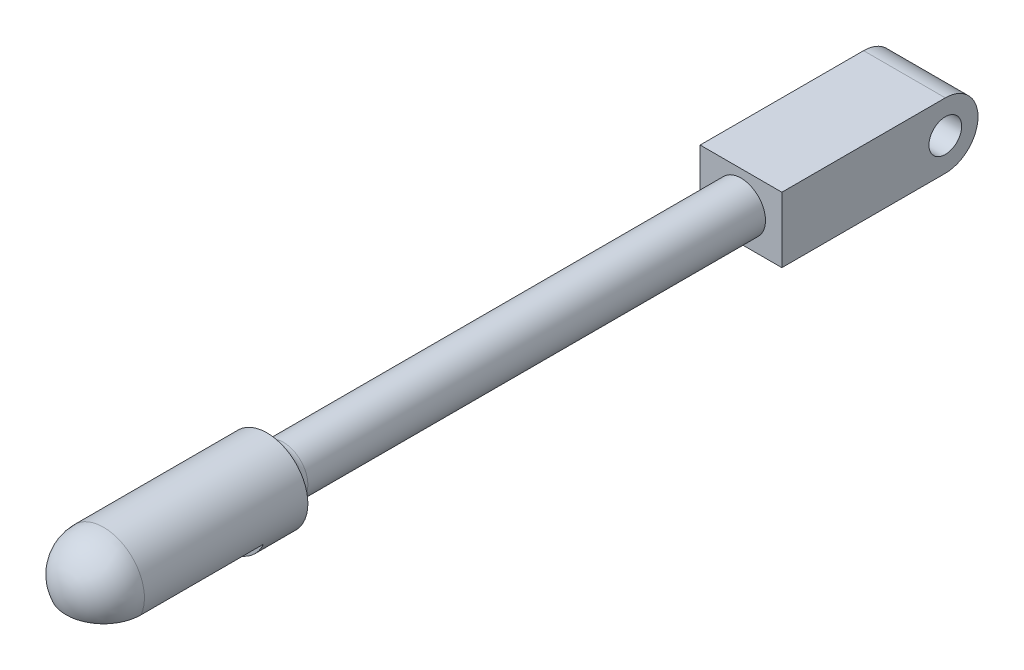
from build123d import *
from build123d.topology import SkipClean

# Parameters (mm, degrees)
SKETCH_1_R          = 1.5
EXTRUDE_1_DEPTH     = 14.5
SKETCH_2_R          = 2.5
EXTRUDE_2_DEPTH     = 10
FILLET_1_R          = 1
CUT_EXTRUDE_1_DEPTH = 10
SKETCH_6_R          = 1
EXTRUDE_3_DEPTH     = 2.5


with BuildPart() as part:
    # 草图1 → 凸台-拉伸1 (new body)
    with BuildSketch(Plane.XY):
        with Locations(Location((0, 0, 0), (0, 0, 180))):
            Circle(SKETCH_1_R)
    extrude_1 = extrude(amount=EXTRUDE_1_DEPTH)

    # 草图2 → 凸台-拉伸2 (add)
    with BuildSketch(Plane.XY.offset(14.5)):
        Circle(SKETCH_2_R)
    extrude(amount=EXTRUDE_2_DEPTH)

    # 圆角1
    fillet_1_edges = [part.edges().sort_by_distance(p)[0] for p in [
        (1.5, 0, 14.5),
    ]]
    fillet(fillet_1_edges, radius=FILLET_1_R - 0.0001)  # a hair under: the kernel refuses the full size

    # 草图3 → 旋转1 (revolve)
    with SkipClean():  # the faces are left unmerged after this step: merging them gives an invalid solid
        with BuildSketch(Plane(origin=(0, 0, 0), x_dir=(0, 0, -1), z_dir=(1, 0, 0))):
            with BuildLine():
                ThreePointArc((-27, 0), (-24.5, -2.5), (-22, 0))
                Line((-22, 0), (-24.5, 0))
                Line((-24.5, 0), (-27, 0))
            make_face()
            with BuildLine():
                Line((-24.5, 0), (-22, 0))
                ThreePointArc((-22, 0), (-24.5, 2.5), (-27, 0))
                Line((-27, 0), (-24.5, 0))
            make_face()
        revolve(axis=Axis((0, 0, 0), (0, 0, 1)))
    add(part.part.scale(1), mode=Mode.REPLACE)  # the faces are merged on a copy

    # 草图4 → 切除-拉伸1 (cut)
    with BuildSketch(Plane.XY.offset(27)):
        Polygon((-2.5, -1), (0, -1), (2.5, -1), (2.5, -3), (-2.5, -3), align=None)
    extrude(amount=-CUT_EXTRUDE_1_DEPTH, mode=Mode.SUBTRACT)

    # 草图5 → 切除-旋转11 (revolve, cut)
    with BuildSketch(Plane(origin=(0, 0, 0), x_dir=(0, 0, -1), z_dir=(1, 0, 0))):
        with BuildLine():
            Line((-22.75, 0), (-26.25, 0))
            ThreePointArc((-26.25, 0), (-24.5, -1.75), (-22.75, 0))
        make_face()
    revolve(axis=Axis((0, 0, 0), (0, 0, 1)), mode=Mode.SUBTRACT)

    # 镜向1: 凸台-拉伸1 across plane
    with SkipClean():  # the faces are left unmerged after this step: merging them gives an invalid solid
        add(extrude_1.mirror(Plane.XY))

    # 草图6 → 凸台-拉伸3 (add, symmetric)
    with BuildSketch(Plane(origin=(0, 0, 0), x_dir=(0, 0, -1), z_dir=(1, 0, 0))):
        with BuildLine():
            Line((24.5, -2), (14.5, -2))
            Line((14.5, -2), (14.5, 0))
            Line((14.5, 0), (14.5, 2))
            Line((14.5, 2), (24.5, 2))
            ThreePointArc((24.5, 2), (26.5, 0), (24.5, -2))
        make_face()
        with Locations((24.5, 0)):
            Circle(SKETCH_6_R, mode=Mode.SUBTRACT)
    extrude(amount=EXTRUDE_3_DEPTH, both=True)


solid = part.part
